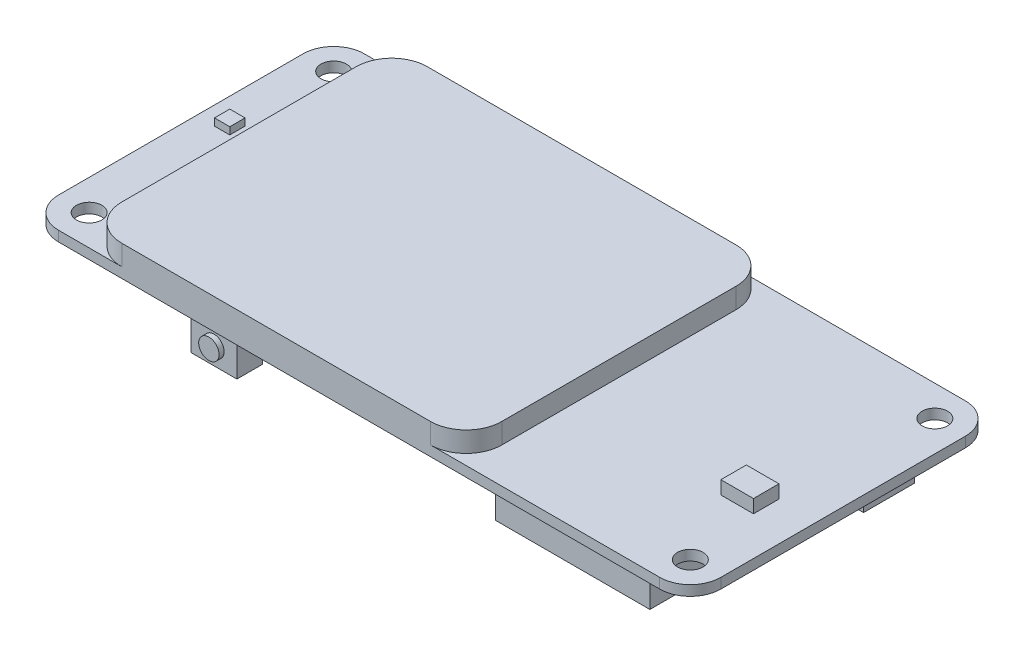
from build123d import *

# Parameters (mm, degrees)
SKETCH_1_R       = 1.25
BOARD_DEPTH      = 1
SKETCH_2_W       = 37.3
SKETCH_2_H       = 30
SCREEN_DEPTH     = 2
SCREEN_RADIUS_R  = 3.5
SKETCH_3_W       = 51
SKETCH_3_H       = 5
PLUG_DEPTH       = 7.5
SKETCH_4_W       = 15.14
SKETCH_4_H       = 20
SPEAKER_DEPTH    = 5
SKETCH_5_W       = 4.5
SKETCH_5_H       = 2.5
BUTTON_DEPTH     = 3.4
SKETCH_6_R       = 1
BUTTON_TAP_DEPTH = 0.5
SKETCH_7_W       = 1.5
SKETCH_7_H       = 1.5
RGB_LED_DEPTH    = 0.7
SKETCH_8_W       = 3.2
SKETCH_8_H       = 2.5
MIC_DEPTH        = 1.3


with BuildPart() as part:
    # 草图1 → board (new body)
    with BuildSketch(Plane(origin=(0, 0, 0), x_dir=(1, 0, 0), z_dir=(0, 1, 0))):
        with BuildLine():
            Line((-29.5, 15), (29.5, 15))
            ThreePointArc((29.5, 15), (31.621320344, 14.121320344), (32.5, 12))
            Line((32.5, 12), (32.5, -12))
            ThreePointArc((32.5, -12), (31.621320344, -14.121320344), (29.5, -15))
            Line((29.5, -15), (-29.5, -15))
            ThreePointArc((-29.5, -15), (-31.621320344, -14.121320344), (-32.5, -12))
            Line((-32.5, -12), (-32.5, 12))
            ThreePointArc((-32.5, 12), (-31.621320344, 14.121320344), (-29.5, 15))
        make_face()
        with Locations((-29.5, 12)):
            Circle(SKETCH_1_R, mode=Mode.SUBTRACT)
        with Locations((29.5, 12)):
            Circle(SKETCH_1_R, mode=Mode.SUBTRACT)
        with Locations((-29.5, -12)):
            Circle(SKETCH_1_R, mode=Mode.SUBTRACT)
        with Locations((29.5, -12)):
            Circle(SKETCH_1_R, mode=Mode.SUBTRACT)
    extrude(amount=BOARD_DEPTH)

    # 草图2 → screen (add)
    with BuildSketch(Plane(origin=(0, 1, 0), x_dir=(1, 0, 0), z_dir=(0, 1, 0))):
        with Locations((-8.15, 0)):
            Rectangle(SKETCH_2_W, SKETCH_2_H)
    extrude(amount=SCREEN_DEPTH)

    # screen-radius
    screen_radius_edges = [part.edges().sort_by_distance(p)[0] for p in [
        (-26.8, 2, -15),
        (10.5, 2, -15),
        (10.5, 2, 15),
        (-26.8, 2, 15),
    ]]
    fillet(screen_radius_edges, radius=SCREEN_RADIUS_R)

    # 草图3 → plug (add)
    with BuildSketch(Plane.XZ):
        with Locations((0, -11.5)):
            Rectangle(SKETCH_3_W, SKETCH_3_H)
    extrude(amount=PLUG_DEPTH)

    # 草图4 → speaker (add)
    with BuildSketch(Plane.XZ):
        with Locations((18.18, 2.216190629)):
            Rectangle(SKETCH_4_W, SKETCH_4_H)
    extrude(amount=SPEAKER_DEPTH)

    # 草图5 → button (add)
    with BuildSketch(Plane.XZ):
        with Locations((-14.75, 13.25)):
            Rectangle(SKETCH_5_W, SKETCH_5_H)
    extrude(amount=BUTTON_DEPTH)

    # 草图6 → button-tap (add)
    with BuildSketch(Plane.XY.offset(14.5)):
        with Locations((-14.75, -1.7)):
            Circle(SKETCH_6_R)
    extrude(amount=BUTTON_TAP_DEPTH)

    # 草图7 → rgb-led (add)
    with BuildSketch(Plane(origin=(0, 1, 0), x_dir=(1, 0, 0), z_dir=(0, 1, 0))):
        with Locations((-29.95, 2.25)):
            Rectangle(SKETCH_7_W, SKETCH_7_H)
    extrude(amount=RGB_LED_DEPTH)

    # 草图8 → mic (add)
    with BuildSketch(Plane(origin=(0, 1, 0), x_dir=(1, 0, 0), z_dir=(0, 1, 0))):
        with Locations((27.1, -3.75)):
            Rectangle(SKETCH_8_W, SKETCH_8_H)
    extrude(amount=MIC_DEPTH)


solid = part.part
